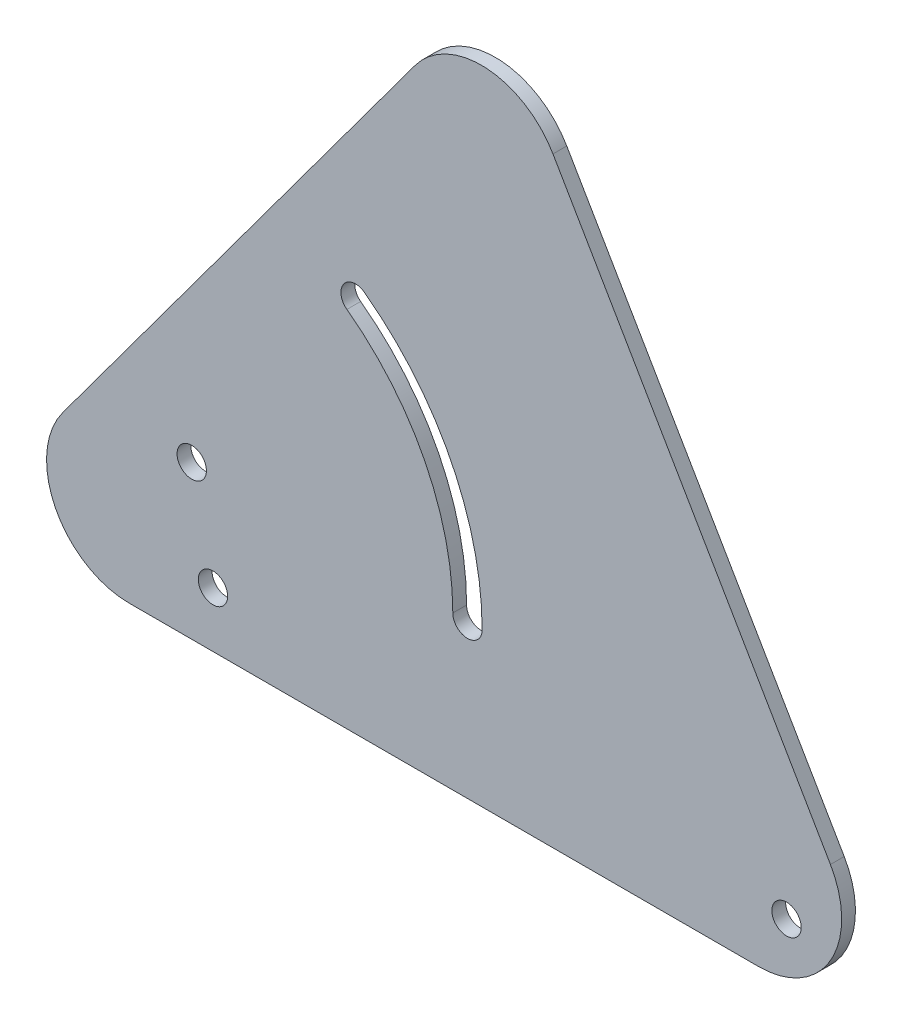
from build123d import *

# Parameters (mm, degrees)
BASE_FLANGE1_DEPTH = 3.175
SKETCH6_R          = 3.3782
CUT_EXTRUDE1_DEPTH = 251.203228354
SKETCH7_R          = 3.3782
CUT_EXTRUDE2_DEPTH = 251.203228354


# Sheet-metal steps are written as plain solids
with BuildPart() as part:
    # Sketch1 → Base-Flange1 (new body)
    with BuildSketch(Plane.XY):
        with BuildLine():
            Line((37.764632708, 0), (182.767027516, 0))
            ThreePointArc((182.767027516, 0), (199.281906874, 9.554671686), (199.230460753, 28.63425094))
            Line((199.230460753, 28.63425094), (135.335454487, 138.390472515))
            ThreePointArc((135.335454487, 138.390472515), (119.911781029, 147.827825072), (103.551346546, 140.127856906))
            Line((103.551346546, 140.127856906), (22.443958003, 30.371635332))
            ThreePointArc((22.443958003, 30.371635332), (20.756110534, 10.470217167), (37.764632708, 0))
        make_face()
    extrude(amount=-BASE_FLANGE1_DEPTH)

    # Sketch6 → Cut-Extrude1 (cut, through all)
    with BuildSketch(Plane.XY):
        with Locations((52.14616343, 35.306)):
            Circle(SKETCH6_R)
        with BuildLine():
            ThreePointArc((119.02436343, 35.306), (111.857415274, 65.4267576), (91.892651201, 89.091781998))
            ThreePointArc((91.892651201, 89.091781998), (87.168081554, 88.382619016), (87.877244536, 83.658049369))
            ThreePointArc((87.877244536, 83.658049369), (105.82505941, 62.383794622), (112.26796343, 35.306))
            ThreePointArc((112.26796343, 35.306), (115.64616343, 31.9278), (119.02436343, 35.306))
        make_face()
    extrude(amount=-CUT_EXTRUDE1_DEPTH, mode=Mode.SUBTRACT)

    # Sketch7 → Cut-Extrude2 (cut, through all)
    with BuildSketch(Plane.XY):
        with Locations((57.037027516, 12.7)):
            Circle(SKETCH7_R)
        with Locations((189.117027516, 12.7)):
            Circle(SKETCH7_R)
    extrude(amount=-CUT_EXTRUDE2_DEPTH, mode=Mode.SUBTRACT)


solid = part.part
